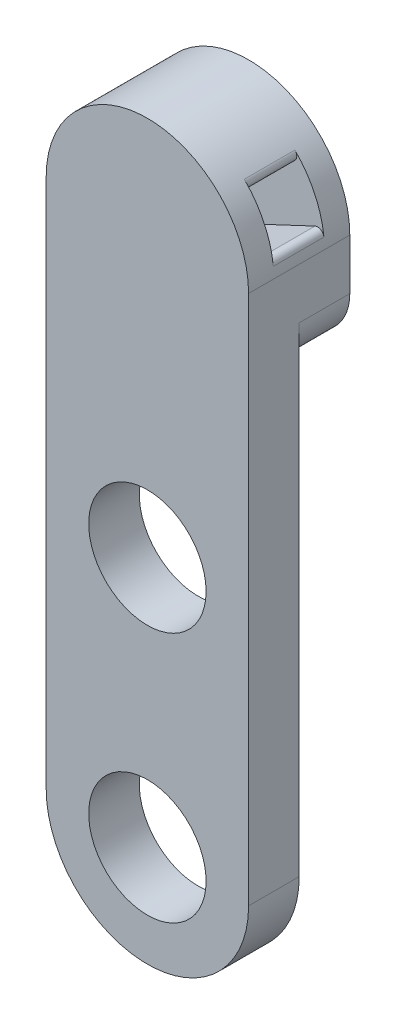
from build123d import *

# Parameters (mm, degrees)
SKETCH3_R               = 1.8414999999999992
SKETCH3_R_2             = 1.8415000000000015
BOSS_EXTRUDE1_DEPTH     = 1.5875
BOSS_EXTRUDE2_START     = -1.5875
SKETCH3_3_R             = 3.1750000000000016
BOSS_EXTRUDE2_DEPTH     = 1.5875
CUT_EXTRUDE1_DEPTH      = 1.5875
CUT_EXTRUDE3_DEPTH      = 14.458066723062892
CUT_EXTRUDE3_DEPTH_BACK = 14.458066723062892
SKETCH9_W               = 1.5874999999999995
SKETCH9_H               = 1.5875000000000021
FILLET1_R               = 1.5875
FILLET3_R               = 0.19845020000000002


with BuildPart() as part:
    # Sketch3 → Boss-Extrude1 (new body)
    with BuildSketch(Plane.XY):
        with BuildLine():
            ThreePointArc((11.11246472217867, 0.03175000000000093), (14.287464722178669, -3.1432499999999988), (17.46246472217867, 0.03174999999999976))
            Line((17.46246472217867, 0.03175000000000054), (17.46246472217867, 16.668750000000003))
            ThreePointArc((17.46246472217867, 16.668750000000003), (14.287464722178667, 19.843750000000004), (11.112464722178665, 16.668750000000003))
            Line((11.112464722178666, 16.668750000000003), (11.11246472217867, 0.03174999999999883))
        make_face()
        with Locations((14.287464722178665, 7.905750000000001)):
            Circle(SKETCH3_R, mode=Mode.SUBTRACT)
        with Locations((14.287464722178669, 0.03175000000000054)):
            Circle(SKETCH3_R_2, mode=Mode.SUBTRACT)
    extrude(amount=BOSS_EXTRUDE1_DEPTH)

    # Sketch3<3> → Boss-Extrude2 (add)
    with BuildSketch(Plane.XY.offset(BOSS_EXTRUDE2_START)):
        with BuildLine():
            Line((14.287464727919362, 13.493750000000004), (17.46246472217867, 13.493750000000004))
            Line((17.46246472217867, 13.493750000000004), (17.46246472217867, 16.668750000000003))
            ThreePointArc((17.46246472217867, 16.668750000000003), (16.5325287544756, 14.423685971762355), (14.287464727919362, 13.493750000000002))
        make_face()
        with BuildLine():
            Line((11.11246472217867, 13.493750000000004), (14.287464727919362, 13.493750000000004))
            ThreePointArc((14.287464727919362, 13.493750000000002), (12.042400693941019, 14.423685967703072), (11.112464722178665, 16.668750000000003))
            Line((11.112464722178666, 16.668750000000003), (11.11246472217867, 13.493750000000004))
        make_face()
        with Locations((14.287464722178667, 16.668750000000003)):
            Circle(SKETCH3_3_R)
        with BuildLine():
            ThreePointArc((11.112464722178665, 10.318750009292732), (12.042400697226496, 12.56381403558241), (14.287464727919362, 13.493750000000002))
            Line((14.287464727919362, 13.493750000000004), (11.11246472217867, 13.493750000000004))
            Line((11.11246472217867, 13.493750000000004), (11.11246472217867, 10.318750009292732))
        make_face()
        with BuildLine():
            ThreePointArc((14.287464727919362, 13.493750000000002), (16.532528754475596, 12.563814028237648), (17.462464722178666, 10.318750000000003))
            Line((17.46246472217867, 10.318750000000003), (17.46246472217867, 13.493750000000004))
            Line((17.46246472217867, 13.493750000000004), (14.287464727919362, 13.493750000000004))
        make_face()
    extrude(amount=BOSS_EXTRUDE2_DEPTH)

    # Sketch4 → Cut-Extrude1 (cut)
    with BuildSketch(Plane(origin=(0, 0, -1.5875), x_dir=(-1, 0, 0), z_dir=(0, 0, -1))):
        with BuildLine():
            ThreePointArc((-11.366464722178668, 12.114801224213839), (-14.28746472217867, 13.747750000000003), (-17.208464722178668, 12.11480122421383))
            ThreePointArc((-17.208464722178668, 12.11480122421383), (-17.345736990888724, 11.869560023967814), (-17.4624647221787, 11.613900956452488))
            Line((-17.46246472217867, 11.613900956452483), (-17.46246472217867, 10.318750000000003))
            ThreePointArc((-17.46246472217867, 10.318750000000005), (-14.287464722178669, 13.493750000000002), (-11.112464722178668, 10.318750000000003))
            Line((-11.112464722178666, 10.318750000000003), (-11.112464722178666, 11.613900956452593))
            ThreePointArc((-11.112464722178673, 11.613900956452591), (-11.229192453468636, 11.86956002396787), (-11.366464722178668, 12.114801224213839))
        make_face()
        with BuildLine():
            Line((-17.46246472217867, 10.318750000000003), (-17.46246472217867, 11.613900956452483))
            ThreePointArc((-17.4624647221787, 11.613900956452488), (-14.947376079862362, 6.9538491099290844), (-10.858464722178665, 10.318750000000003))
            ThreePointArc((-10.858464722178665, 10.318750000000003), (-10.922563832107757, 10.978661357683757), (-11.112464722178673, 11.613900956452591))
            Line((-11.112464722178666, 11.613900956452593), (-11.112464722178666, 10.318750000000003))
            ThreePointArc((-11.112464722178668, 10.318750000000003), (-14.287464722178669, 13.493750000000002), (-17.46246472217867, 10.318750000000005))
        make_face()
    extrude(amount=-CUT_EXTRUDE1_DEPTH, mode=Mode.SUBTRACT)

    # Sketch9 → Cut-Extrude3 (cut, two sides: drawn at the far end of the back side and taken through both)
    with BuildSketch(Plane(origin=(14.949330355898779, 7.042270953374606, 0), x_dir=(0, 0, 1), z_dir=(-0.9046486230783365, -0.42615826726988393, 0)).offset(-CUT_EXTRUDE3_DEPTH_BACK)):
        with Locations((-1.1e-16, 9.003381908558007)):
            Rectangle(SKETCH9_W, SKETCH9_H)
    extrude(amount=CUT_EXTRUDE3_DEPTH + CUT_EXTRUDE3_DEPTH_BACK, mode=Mode.SUBTRACT)

    # Fillet1
    # the kernel refuses this fillet: 1.5875 mm, written as the material it takes off along each edge
    with BuildSketch(Plane(origin=(11.112464722178668, 11.613900956452579, 0), x_dir=(-5.1e-16, 1, 0), z_dir=(0, 0, -1))) as fillet1_piece_1:
        with BuildLine():
            CenterArc((3.463537518327043, 1.5875000000000004), FILLET1_R, 161.5512847696779, 108.44871523032214)
            ThreePointArc((1.9576234440297167, 2.0898734177215426), (1.2074075320922062, 0.8308067461464439), (0, 0))
            Line((0, 0), (3.463537518327044, 0))
        make_face()
    extrude(amount=10.24634379581761, mode=Mode.SUBTRACT)
    with BuildSketch(Plane(origin=(17.46246472217867, 11.613900956453127, 0), x_dir=(0, 1, 0), z_dir=(0, 0, -1))) as fillet1_piece_2:
        with BuildLine():
            CenterArc((3.4635375183265698, -1.5875000000000004), FILLET1_R, 90, 108.44871523031935)
            ThreePointArc((1.9576234440292186, -2.0898734177214706), (1.2074075320919153, -0.8308067461464965), (0, 0))
            Line((0, 0), (3.4635375183265698, 0))
        make_face()
    extrude(amount=10.246343795816424, mode=Mode.SUBTRACT)

    # Fillet3
    fillet3_edges = [part.edges().sort_by_distance(p)[0] for p in [
        (16.72182330744723, 18.70701477139974, -1.1e-16),
        (17.404301856828425, 17.273689068062478, -1.1e-16),
        (11.112464722178666, 14.309755511050398, 0.3968749999999998),
        (11.112464722178666, 16.064580488949616, -1.1e-16),
        (11.271579474224783, 14.38471065418466, -0.3968749999999999),
    ]]
    fillet(fillet3_edges, radius=FILLET3_R)


solid = part.part
